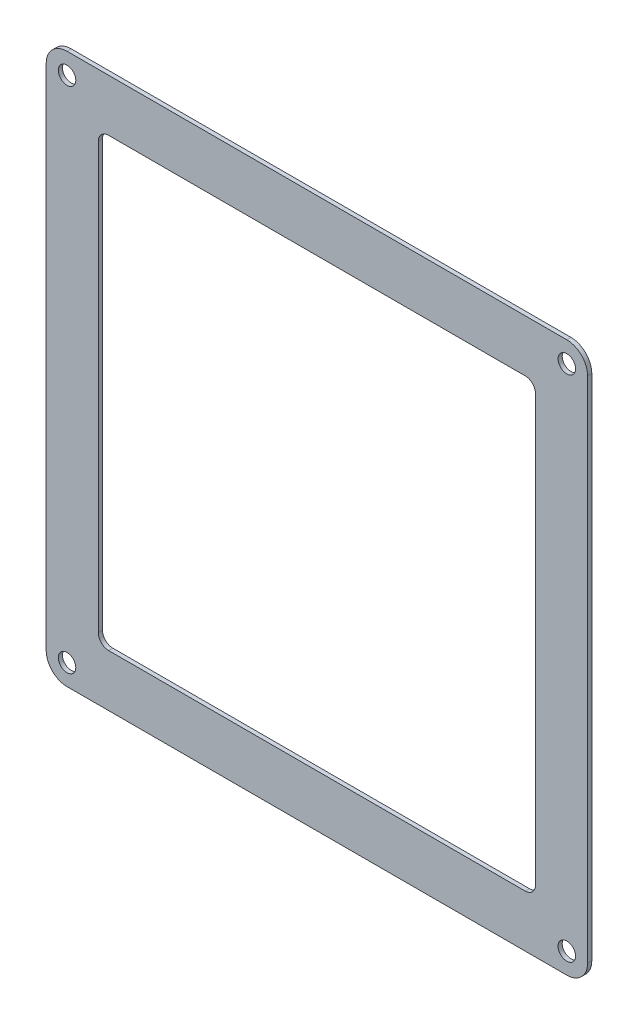
from build123d import *

# Parameters (mm, degrees)
SKETCH_1_W              = 260
SKETCH_1_H              = 264.25
SKETCH_1_W_2            = 210
SKETCH_1_H_2            = 214.25
EXTRUDE_1_DEPTH         = 2
FILLET_1_R              = 10
FILLET_2_R              = 5
HOLE_WIZARD_8_4_8_4_1_D = 8.4


with BuildPart() as part:
    # 草图1 → 凸台-拉伸1 (new body)
    with BuildSketch(Plane.XY):
        Rectangle(SKETCH_1_W, SKETCH_1_H)
        Rectangle(SKETCH_1_W_2, SKETCH_1_H_2, mode=Mode.SUBTRACT)
    extrude(amount=EXTRUDE_1_DEPTH)

    # 圆角1
    fillet_1_edges = [part.edges().sort_by_distance(p)[0] for p in [
        (130, 132.125, 1),
        (130, -132.125, 1),
        (-130, -132.125, 1),
        (-130, 132.125, 1),
    ]]
    fillet(fillet_1_edges, radius=FILLET_1_R)

    # 圆角2
    fillet_2_edges = [part.edges().sort_by_distance(p)[0] for p in [
        (-105, 107.125, 1),
        (-105, -107.125, 1),
        (105, -107.125, 1),
        (105, 107.125, 1),
    ]]
    fillet(fillet_2_edges, radius=FILLET_2_R)

    # Ø8.4 (8.4) 直径孔1 (through all)
    with Locations(Plane.XY.offset(2)):
        with Locations((120, -122.125), (-120, 122.125), (-120, -122.125), (120, 122.125)):
            Hole(HOLE_WIZARD_8_4_8_4_1_D / 2)


solid = part.part
